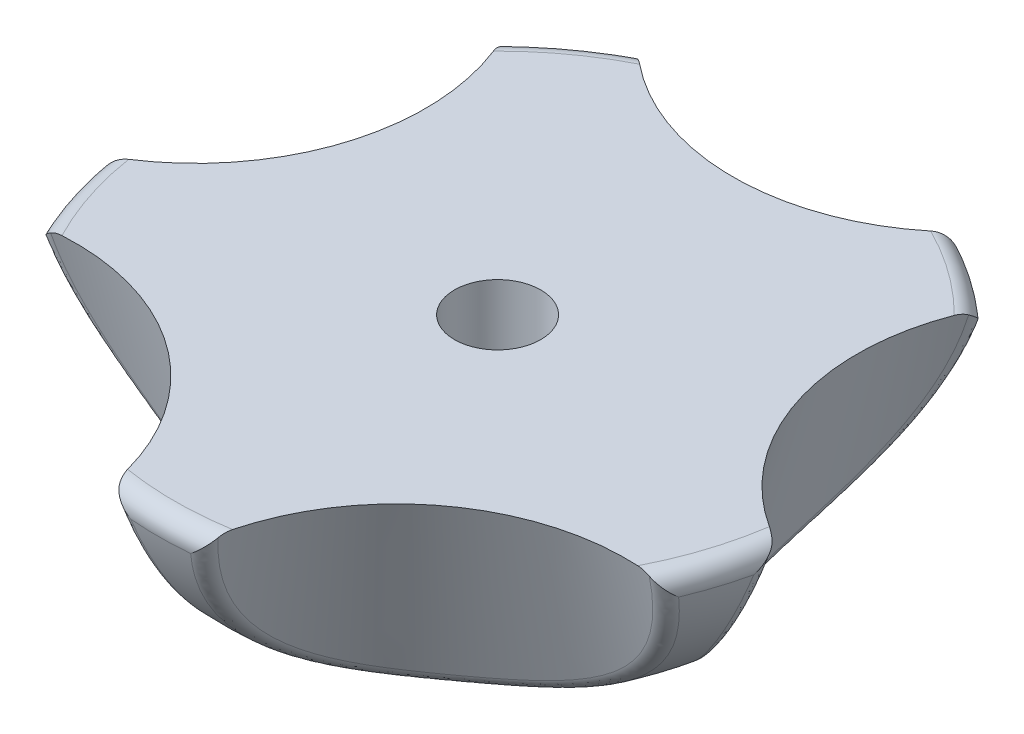
from build123d import *

# Parameters (mm, degrees)
ESQUISSE1_R                         = 20
ESQUISSE1_R_2                       = 2.5
BOSS_EXTRU_1_DEPTH                  = 12
CONG_7_R                            = 15
ENL_V_MAT_EXTRU_1_DEPTH             = 31.724583161
ENL_V_MAT_EXTRU_1_DRAFT             = 15
R_P_TITION_CIRCULAIRE1_COPY_1_DEPTH = 31.724583161
R_P_TITION_CIRCULAIRE1_COPY_1_DRAFT = 15
R_P_TITION_CIRCULAIRE1_COPY_2_DEPTH = 31.724583161
R_P_TITION_CIRCULAIRE1_COPY_2_DRAFT = 15
R_P_TITION_CIRCULAIRE1_COPY_3_DEPTH = 31.724583161
R_P_TITION_CIRCULAIRE1_COPY_3_DRAFT = 15
R_P_TITION_CIRCULAIRE1_COPY_4_DEPTH = 31.724583161
R_P_TITION_CIRCULAIRE1_COPY_4_DRAFT = 15
ESQUISSE3_R                         = 5.303061543
ENL_V_MAT_EXTRU_2_DEPTH             = 2
ENL_V_MAT_EXTRU_2_DRAFT             = -45
CONG_9_R                            = 1


with BuildPart() as part:
    # Esquisse1 → Boss.-Extru.1 (new body)
    with BuildSketch(Plane(origin=(0, 0, 0), x_dir=(1, 0, 0), z_dir=(0, 1, 0))):
        with Locations(Location((0, 0, 0), (0, 0, 270))):
            Circle(ESQUISSE1_R)
        with Locations(Location((0, 0, 0), (0, 0, 270))):
            Circle(ESQUISSE1_R_2, mode=Mode.SUBTRACT)
    extrude(amount=BOSS_EXTRU_1_DEPTH)

    # Congé7
    # the kernel refuses this fillet: 15 mm, written as the material it takes off along each edge
    with BuildSketch(Plane(origin=(0, 0, 0), x_dir=(0, 0, 1), z_dir=(-1, 0, 0))) as cong_7_piece_1:
        with BuildLine():
            CenterArc((5.303061543, 15), CONG_7_R, 270, 78.463040967)
            Line((5.303061543, 0), (5.303061543, -0.3))
            Line((5.303061543, -0.3), (20, -0.3))
            Line((20, -0.3), (20.3, 0))
            ThreePointArc((20.3, 0), (20.3, 6), (20.293938769, 11.94))
            Line((20.293938769, 11.94), (20, 12))
        make_face()
    revolve(axis=Axis((0, 0, 0), (0, 1, 0)), mode=Mode.SUBTRACT)


with BuildPart() as enl_v_mat_extru_1_tool:
    # Esquisse2 → Enlèv. mat.-Extru.1 (with draft: the straight prism first)
    with BuildSketch(Plane(origin=(0, 12, 0), x_dir=(1, 0, 0), z_dir=(0, 1, 0))):
        with BuildLine():
            ThreePointArc((-9.482558577, 17.609119309), (-0.04876919, 13.740685893), (9.357322758, 17.675986841))
            ThreePointArc((9.357322758, 17.675986841), (-0.070984641, 19.999874029), (-9.482558577, 17.609119309))
        make_face()
    extrude(amount=-ENL_V_MAT_EXTRU_1_DEPTH)
    # Enlèv. mat.-Extru.1: the draft: its side faces are tilted about the plane it starts from
    enl_v_mat_extru_1_sides = [enl_v_mat_extru_1_tool.faces().sort_by_distance(p)[0] for p in [
        (-0.04876919, -3.86229158, -13.740685893),
        (-0.070984641, -3.86229158, -19.999874029),
    ]]
    draft(enl_v_mat_extru_1_sides, Plane(origin=(0, 12, 0), x_dir=(1, 0, 0), z_dir=(0, 1, 0)), ENL_V_MAT_EXTRU_1_DRAFT)


with BuildPart() as part_1:
    add(part.part)

    # Enlèv. mat.-Extru.1: cut by enl_v_mat_extru_1_tool
    add(enl_v_mat_extru_1_tool.part, mode=Mode.SUBTRACT)


with BuildPart() as r_p_tition_circulaire1_copy_1_tool:
    # Répétition circulaire1 copy 1 sketch → Répétition circulaire1 copy 1 (with draft: the straight prism first)
    with BuildSketch(Plane(origin=(0, 12, 0), x_dir=(0.30901699437494745, 0, -0.9510565162951535), z_dir=(0, 1, 0))):
        with BuildLine():
            ThreePointArc((-9.482558577, 17.609119309), (-0.04876919, 13.740685893), (9.357322758, 17.675986841))
            ThreePointArc((9.357322758, 17.675986841), (-0.070984641, 19.999874029), (-9.482558577, 17.609119309))
        make_face()
    extrude(amount=-R_P_TITION_CIRCULAIRE1_COPY_1_DEPTH)
    # Répétition circulaire1 copy 1: the draft: its side faces are tilted about the plane it starts from
    r_p_tition_circulaire1_copy_1_sides = [r_p_tition_circulaire1_copy_1_tool.faces().sort_by_distance(p)[0] for p in [
        (-13.083239365, -3.86229158, -4.199723199),
        (-19.042945981, -3.86229158, -6.112790555),
    ]]
    draft(r_p_tition_circulaire1_copy_1_sides, Plane(origin=(0, 12, 0), x_dir=(0.30901699437494745, 0, -0.9510565162951535), z_dir=(0, 1, 0)), R_P_TITION_CIRCULAIRE1_COPY_1_DRAFT)


with BuildPart() as part_2:
    add(part_1.part)

    # Répétition circulaire1 copy 1: cut by r_p_tition_circulaire1_copy_1_tool
    add(r_p_tition_circulaire1_copy_1_tool.part, mode=Mode.SUBTRACT)


with BuildPart() as r_p_tition_circulaire1_copy_2_tool:
    # Répétition circulaire1 copy 2 sketch → Répétition circulaire1 copy 2 (with draft: the straight prism first)
    with BuildSketch(Plane(origin=(0, 12, 0), x_dir=(-0.8090169943749473, 0, -0.5877852522924732), z_dir=(0, 1, 0))):
        with BuildLine():
            ThreePointArc((-9.482558577, 17.609119309), (-0.04876919, 13.740685893), (9.357322758, 17.675986841))
            ThreePointArc((9.357322758, 17.675986841), (-0.070984641, 19.999874029), (-9.482558577, 17.609119309))
        make_face()
    extrude(amount=-R_P_TITION_CIRCULAIRE1_COPY_2_DEPTH)
    # Répétition circulaire1 copy 2: the draft: its side faces are tilted about the plane it starts from
    r_p_tition_circulaire1_copy_2_sides = [r_p_tition_circulaire1_copy_2_tool.faces().sort_by_distance(p)[0] for p in [
        (-8.037117421, -3.86229158, 11.145114212),
        (-11.698203221, -3.86229158, 16.2219617),
    ]]
    draft(r_p_tition_circulaire1_copy_2_sides, Plane(origin=(0, 12, 0), x_dir=(-0.8090169943749473, 0, -0.5877852522924732), z_dir=(0, 1, 0)), R_P_TITION_CIRCULAIRE1_COPY_2_DRAFT)


with BuildPart() as part_3:
    add(part_2.part)

    # Répétition circulaire1 copy 2: cut by r_p_tition_circulaire1_copy_2_tool
    add(r_p_tition_circulaire1_copy_2_tool.part, mode=Mode.SUBTRACT)


with BuildPart() as r_p_tition_circulaire1_copy_3_tool:
    # Répétition circulaire1 copy 3 sketch → Répétition circulaire1 copy 3 (with draft: the straight prism first)
    with BuildSketch(Plane(origin=(0, 12, 0), x_dir=(-0.8090169943749476, 0, 0.587785252292473), z_dir=(0, 1, 0))):
        with BuildLine():
            ThreePointArc((-9.482558577, 17.609119309), (-0.04876919, 13.740685893), (9.357322758, 17.675986841))
            ThreePointArc((9.357322758, 17.675986841), (-0.070984641, 19.999874029), (-9.482558577, 17.609119309))
        make_face()
    extrude(amount=-R_P_TITION_CIRCULAIRE1_COPY_3_DEPTH)
    # Répétition circulaire1 copy 3: the draft: its side faces are tilted about the plane it starts from
    r_p_tition_circulaire1_copy_3_sides = [r_p_tition_circulaire1_copy_3_tool.faces().sort_by_distance(p)[0] for p in [
        (8.116027628, -3.86229158, 11.087782591),
        (11.813058783, -3.86229158, 16.13851425),
    ]]
    draft(r_p_tition_circulaire1_copy_3_sides, Plane(origin=(0, 12, 0), x_dir=(-0.8090169943749476, 0, 0.587785252292473), z_dir=(0, 1, 0)), R_P_TITION_CIRCULAIRE1_COPY_3_DRAFT)


with BuildPart() as part_4:
    add(part_3.part)

    # Répétition circulaire1 copy 3: cut by r_p_tition_circulaire1_copy_3_tool
    add(r_p_tition_circulaire1_copy_3_tool.part, mode=Mode.SUBTRACT)


with BuildPart() as r_p_tition_circulaire1_copy_4_tool:
    # Répétition circulaire1 copy 4 sketch → Répétition circulaire1 copy 4 (with draft: the straight prism first)
    with BuildSketch(Plane(origin=(0, 12, 0), x_dir=(0.30901699437494723, 0, 0.9510565162951536), z_dir=(0, 1, 0))):
        with BuildLine():
            ThreePointArc((-9.482558577, 17.609119309), (-0.04876919, 13.740685893), (9.357322758, 17.675986841))
            ThreePointArc((9.357322758, 17.675986841), (-0.070984641, 19.999874029), (-9.482558577, 17.609119309))
        make_face()
    extrude(amount=-R_P_TITION_CIRCULAIRE1_COPY_4_DEPTH)
    # Répétition circulaire1 copy 4: the draft: its side faces are tilted about the plane it starts from
    r_p_tition_circulaire1_copy_4_sides = [r_p_tition_circulaire1_copy_4_tool.faces().sort_by_distance(p)[0] for p in [
        (13.053098348, -3.86229158, -4.292487711),
        (18.99907506, -3.86229158, -6.247811366),
    ]]
    draft(r_p_tition_circulaire1_copy_4_sides, Plane(origin=(0, 12, 0), x_dir=(0.30901699437494723, 0, 0.9510565162951536), z_dir=(0, 1, 0)), R_P_TITION_CIRCULAIRE1_COPY_4_DRAFT)


with BuildPart() as part_5:
    add(part_4.part)

    # Répétition circulaire1 copy 4: cut by r_p_tition_circulaire1_copy_4_tool
    add(r_p_tition_circulaire1_copy_4_tool.part, mode=Mode.SUBTRACT)


with BuildPart() as enl_v_mat_extru_2_tool:
    # Esquisse3 → Enlèv. mat.-Extru.2 (with draft: the straight prism first)
    with BuildSketch(Plane.XZ):
        Circle(ESQUISSE3_R)
    extrude(amount=-ENL_V_MAT_EXTRU_2_DEPTH)
    # Enlèv. mat.-Extru.2: the draft: its side faces are tilted about the plane it starts from
    enl_v_mat_extru_2_sides = [enl_v_mat_extru_2_tool.faces().sort_by_distance(p)[0] for p in [
        (-5.303061543, 1, 0),
    ]]
    draft(enl_v_mat_extru_2_sides, Plane.XZ, ENL_V_MAT_EXTRU_2_DRAFT)


with BuildPart() as part_6:
    add(part_5.part)

    # Enlèv. mat.-Extru.2: cut by enl_v_mat_extru_2_tool
    add(enl_v_mat_extru_2_tool.part, mode=Mode.SUBTRACT)

    # Congé9
    cong_9_edges = [part_6.edges().sort_by_distance(p)[0] for p in [
        (-11.813058783, 12, -16.13851425),
        (-0.038351506, 1.045706429, -10.805510265),
        (-18.99907506, 12, 6.247811366),
        (1.413258416, 12, 19.950005029),
        (19.042945981, 12, 6.112790555),
        (11.698203221, 12, -16.2219617),
        (10.264799682, 1.045706429, -3.375560754),
        (6.382346597, 1.045706429, 8.719298988),
        (-6.320292557, 1.045706429, 8.764383887),
        (-10.288502216, 1.045706429, -3.302611855),
        (-3.749830778, 0, -3.749830778),
    ]]
    fillet(cong_9_edges, radius=CONG_9_R)


solid = part_6.part
